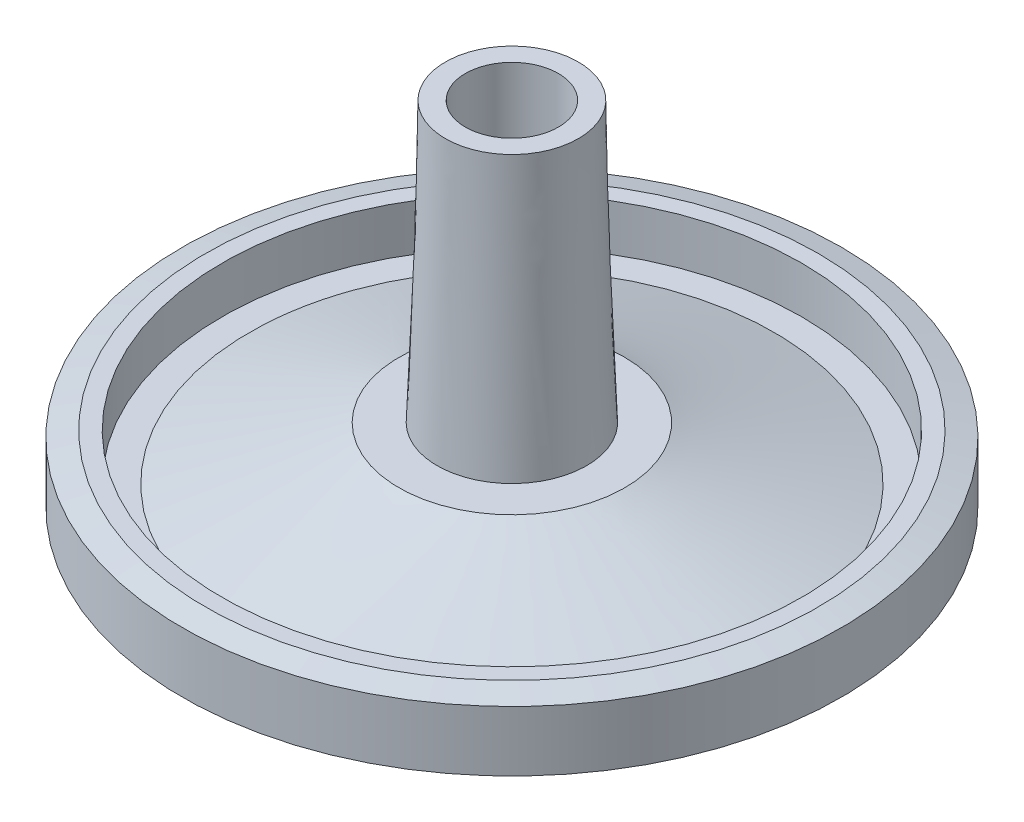
from build123d import *

# Parameters (mm, degrees)
SKETCH3_R           = 3.5
CUT_EXTRUDE1_DEPTH  = 8.5
SKETCH6_R           = 24.8
SKETCH6_R_2         = 21.8
BOSS_EXTRUDE1_DEPTH = 3.5
CHAMFER1_SIZE       = 1.75
CHAMFER1_SIZE2      = 0.468911087
SKETCH7_R           = 24.8
BOSS_EXTRUDE2_DEPTH = 1.5
SKETCH8_R           = 22.5
SKETCH8_R_2         = 20.5
BOSS_EXTRUDE3_DEPTH = 1
SKETCH10_R          = 9.5
SKETCH9_R           = 19.5
FILLET1_R           = 0.5
SKETCH13_R          = 3.75
CUT_EXTRUDE2_DEPTH  = 13.5
SKETCH14_R          = 2.5
CUT_EXTRUDE4_DEPTH  = 40.196045764


with BuildPart() as part:
    # Loft1: read off the stored shape, not the designer's step
    # Loft1: loft between two sections, ruled curve by curve
    loft1_from = [
        Edge.make_bspline([(-3.039651488, 0, -3.969951993), (4.900252498, 0, -10.04925497), (10.979555475, 0, -2.109350984), (3.039651488, 0, 3.969951993), (-4.900252498, 0, 10.04925497), (-10.979555475, 0, 2.109350984), (-3.039651488, 0, -3.969951993)], [0, 0, 0, 0, 0.5, 0.5, 0.5, 1, 1, 1, 1], 3, [1, 0.333333333, 0.333333333, 1, 0.333333333, 0.333333333, 1]),
    ]
    loft1_to = [
        Edge.make_bspline([(-4.7341345, -21, -3.037860355), (1.341586209, -21, -12.506129355), (10.809855209, -21, -6.430408646), (4.7341345, -21, 3.037860355), (-1.341586209, -21, 12.506129355), (-10.809855209, -21, 6.430408646), (-4.7341345, -21, -3.037860355)], [0, 0, 0, 0, 0.5, 0.5, 0.5, 1, 1, 1, 1], 3, [1, 0.333333333, 0.333333333, 1, 0.333333333, 0.333333333, 1]),
    ]
    loft1 = Solid(Shell([*[Face.make_surface_from_curves(loft1_from[k], loft1_to[k]) for k in range(1)], Face(Wire(loft1_from)), Face(Wire(loft1_to))]))
    add(loft1)

    # Sketch3 → Cut-Extrude1 (cut)
    with BuildSketch(Plane(origin=(0, 0, 0), x_dir=(1, 0, 0), z_dir=(0, 1, 0))):
        with Locations(Location((0, 0, 0), (0, 0, 270))):
            Circle(SKETCH3_R)
    extrude(amount=-CUT_EXTRUDE1_DEPTH, mode=Mode.SUBTRACT)

    # Loft2: read off the stored shape, not the designer's step
    # Loft2: loft between two sections, ruled curve by curve
    loft2_from = [
        Edge.make_bspline([(-8.492912142, -21, 0.347049492), (-9.187011126, -21, -16.638774792), (7.798813158, -21, -17.332873776), (8.492912142, -21, -0.347049492), (9.187011126, -21, 16.638774792), (-7.798813158, -21, 17.332873776), (-8.492912142, -21, 0.347049492)], [0, 0, 0, 0, 0.5, 0.5, 0.5, 1, 1, 1, 1], 3, [1, 0.333333333, 0.333333333, 1, 0.333333333, 0.333333333, 1]),
    ]
    loft2_to = [
        Edge.make_bspline([(-17.859752941, -25, -8.431590887), (-0.996571166, -25, -44.151096769), (34.722934715, -25, -27.287914995), (17.859752941, -25, 8.431590887), (0.996571166, -25, 44.151096769), (-34.722934715, -25, 27.287914995), (-17.859752941, -25, -8.431590887)], [0, 0, 0, 0, 0.5, 0.5, 0.5, 1, 1, 1, 1], 3, [1, 0.333333333, 0.333333333, 1, 0.333333333, 0.333333333, 1]),
    ]
    loft2 = Solid(Shell([*[Face.make_surface_from_curves(loft2_from[k], loft2_to[k]) for k in range(1)], Face(Wire(loft2_from)), Face(Wire(loft2_to))]))
    add(loft2)



with BuildPart() as body_2:
    # Sketch6 → Boss-Extrude1 (new body)
    with BuildSketch(Plane.XZ.offset(25)):
        with Locations(Location((0, 0, 0), (0, 0, 270))):
            Circle(SKETCH6_R)
        with Locations(Location((0, 0, 0), (0, 0, 270))):
            Circle(SKETCH6_R_2, mode=Mode.SUBTRACT)
    extrude(amount=-BOSS_EXTRUDE1_DEPTH)

    # Chamfer1
    chamfer1_edges = [body_2.edges().sort_by_distance(p)[0] for p in [
        (0, -21.5, 24.8),
    ]]
    chamfer1_side = [body_2.faces().sort_by_distance(p)[0] for p in [
        (0, -21.5, 24.098550073),
    ]]
    chamfer(chamfer1_edges, length=CHAMFER1_SIZE, length2=CHAMFER1_SIZE2, reference=chamfer1_side[0])


with BuildPart() as part_1:
    add(part.part)

    add(body_2.part)  # Boss-Extrude2 merges body 2
    # Sketch7 → Boss-Extrude2 (add)
    with BuildSketch(Plane.XZ.offset(25)):
        with Locations(Location((0, 0, 0), (0, 0, 270))):
            Circle(SKETCH7_R)
    extrude(amount=BOSS_EXTRUDE2_DEPTH)

    # Sketch8 → Boss-Extrude3 (add)
    with BuildSketch(Plane.XZ.offset(26.5)):
        with Locations(Location((0, 0, 0), (0, 0, 270))):
            Circle(SKETCH8_R)
        with Locations(Location((0, 0, 0), (0, 0, 270))):
            Circle(SKETCH8_R_2, mode=Mode.SUBTRACT)
    extrude(amount=BOSS_EXTRUDE3_DEPTH)

    # Sketch10 → Cut-Loft1 section 0
    with BuildSketch(Plane(origin=(0, -23.5, 0), x_dir=(-1, 0, 0), z_dir=(0, -1, 0))):
        Circle(SKETCH10_R)
    # Sketch9 → Cut-Loft1 section 1
    with BuildSketch(Plane.XZ.offset(26.5)):
        Circle(SKETCH9_R)
    loft(mode=Mode.SUBTRACT)

    # Fillet1
    fillet1_edges = [part_1.edges().sort_by_distance(p)[0] for p in [
        (0, -26.5, 20.5),
        (0, -27.5, 22.5),
        (0, -26.5, 22.5),
        (0, -27.5, 20.5),
    ]]
    fillet(fillet1_edges, radius=FILLET1_R - 0.0001)  # a hair under: the kernel refuses the full size

    # Cut-Loft2: read off the stored shape, not the designer's step
    # Cut-Loft2: loft between two sections, ruled curve by curve
    cut_loft2_from = [
        Edge.make_bspline([(-4.335353506, -23.5, -2.490925527), (-9.317204559, -23.5, 6.179781485), (-0.646497548, -23.5, 11.161632538), (4.335353506, -23.5, 2.490925527), (9.317204559, -23.5, -6.179781485), (0.646497548, -23.5, -11.161632538), (-4.335353506, -23.5, -2.490925527)], [0, 0, 0, 0, 0.5, 0.5, 0.5, 1, 1, 1, 1], 3, [1, 0.333333333, 0.333333333, 1, 0.333333333, 0.333333333, 1]),
    ]
    cut_loft2_to = [
        Edge.make_bspline([(-3.672562621, -19.5, 0.758144968), (-2.156272685, -19.5, 8.103270211), (5.188852558, -19.5, 6.586980274), (3.672562621, -19.5, -0.758144968), (2.156272685, -19.5, -8.103270211), (-5.188852558, -19.5, -6.586980274), (-3.672562621, -19.5, 0.758144968)], [0, 0, 0, 0, 0.5, 0.5, 0.5, 1, 1, 1, 1], 3, [1, 0.333333333, 0.333333333, 1, 0.333333333, 0.333333333, 1]),
    ]
    cut_loft2 = Solid(Shell([*[Face.make_surface_from_curves(cut_loft2_from[k], cut_loft2_to[k]) for k in range(1)], Face(Wire(cut_loft2_from)), Face(Wire(cut_loft2_to))]))
    add(cut_loft2, mode=Mode.SUBTRACT)

    # Sketch13 → Cut-Extrude2 (cut)
    with BuildSketch(Plane.XZ.offset(23.5)):
        with Locations(Location((0, 0, 0), (0, 0, 270))):
            Circle(SKETCH13_R)
    extrude(amount=-CUT_EXTRUDE2_DEPTH, mode=Mode.SUBTRACT)

    # Sketch14 → Cut-Extrude4 (cut, through all)
    with BuildSketch(Plane.XZ.offset(10)):
        with Locations(Location((0, 0, 0), (0, 0, 270))):
            Circle(SKETCH14_R)
    extrude(amount=-CUT_EXTRUDE4_DEPTH, mode=Mode.SUBTRACT)


solid = part_1.part
